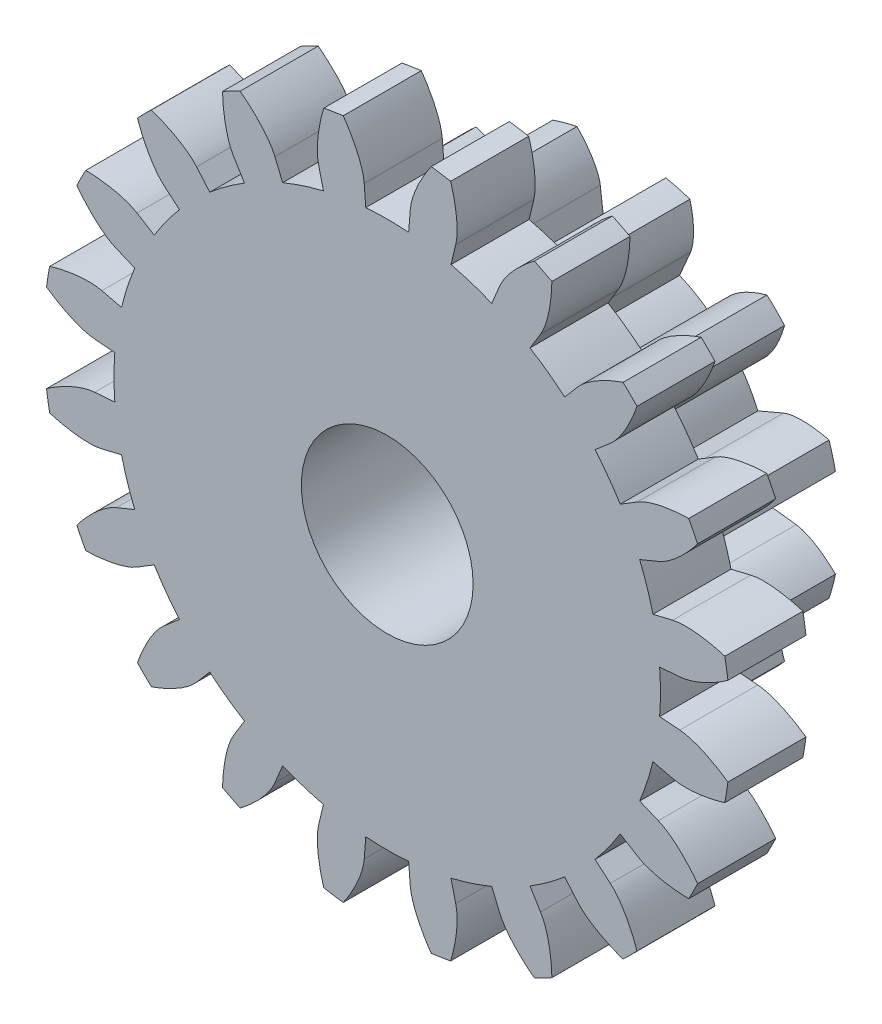
from build123d import *

# Parameters (mm, degrees)
SKETCH_1_R               = 2.8
SKETCH_1_R_2             = 1.1
EXTRUDE_1_DEPTH          = 2
CUT_EXTRUDE_1_DEPTH      = 5.436214603
PATTERN_CIRCULAR_1_COUNT = 12
PATTERN_CIRCULAR_1_ANGLE = 330
SKETCH_2_R               = 4.4
SKETCH_2_R_2             = 1.1
EXTRUDE_2_DEPTH          = 1
CUT_EXTRUDE_3_DEPTH      = 7.536054021
PATTERN_CIRCULAR_2_COUNT = 20


with BuildPart() as part:
    # 草图1 → 凸台-拉伸1 (new body)
    with BuildSketch(Plane.XY):
        Circle(SKETCH_1_R)
        Circle(SKETCH_1_R_2, mode=Mode.SUBTRACT)
    extrude(amount=EXTRUDE_1_DEPTH)

    # 草图1<3> → 切除-拉伸1 (cut, through all)
    with BuildSketch(Plane.XY):
        with BuildLine():
            Line((2.238939613, 0.270845719), (1.886248568, 0.228180496))
            ThreePointArc((1.886248568, 0.228180496), (1.896559026, 0.114297245), (1.9, 0))
            ThreePointArc((1.9, 0), (1.896559026, -0.114297245), (1.886248568, -0.228180496))
            Line((1.886248568, -0.228180496), (2.238939613, -0.270845719))
            add(Edge.make_bspline(
                [(2.238939613, -0.270845719), (2.256006445, -0.272910303), (2.303205171, -0.282218978), (2.389840348, -0.313934827), (2.521092361, -0.383706427), (2.626494766, -0.462754174), (2.701143377, -0.529750704), (2.741484226, -0.569442044)],
                knots=[0, 0, 0, 0, 0, 0.005604068, 0.015718248, 0.029959916, 0.048452597, 0.048452597, 0.048452597, 0.048452597, 0.048452597], degree=4))
            ThreePointArc((2.741484226, -0.569442044), (2.78533264, -0.286220342), (2.8, 0))
            ThreePointArc((2.8, 0), (2.78533264, 0.286220342), (2.741484226, 0.569442044))
            add(Edge.make_bspline(
                [(2.238939613, 0.270845719), (2.256006445, 0.272910303), (2.303205171, 0.282218978), (2.389840348, 0.313934827), (2.521092361, 0.383706427), (2.626494766, 0.462754174), (2.701143377, 0.529750704), (2.741484226, 0.569442044)],
                knots=[0, 0, 0, 0, 0, 0.005604068, 0.015718248, 0.029959916, 0.048452597, 0.048452597, 0.048452597, 0.048452597, 0.048452597], degree=4))
        make_face()
    cut_extrude_1 = extrude(amount=CUT_EXTRUDE_1_DEPTH, mode=Mode.SUBTRACT)

    # 阵列(圆周)1: 切除-拉伸1 ×12 about axis
    pattern_circular_1_axis = Axis((0, 0, 2), (0, 0, 1))
    for i in range(1, PATTERN_CIRCULAR_1_COUNT):
        add(cut_extrude_1.rotate(pattern_circular_1_axis, i * PATTERN_CIRCULAR_1_ANGLE / (PATTERN_CIRCULAR_1_COUNT - 1)), mode=Mode.SUBTRACT)

    # 草图2 → 凸台-拉伸2 (add)
    with BuildSketch(Plane.XY.offset(2)):
        Circle(SKETCH_2_R)
        Circle(SKETCH_2_R_2, mode=Mode.SUBTRACT)
    extrude(amount=EXTRUDE_2_DEPTH)

    # 草图2<3> → 切除-拉伸3 (cut, through all)
    with BuildSketch(Plane.XY.offset(2)):
        with BuildLine():
            Line((3.747183448, 0.294909733), (3.489210668, 0.274606835))
            ThreePointArc((3.489210668, 0.274606835), (3.497301627, 0.137409355), (3.5, 0))
            ThreePointArc((3.5, 0), (3.497301627, -0.137409355), (3.489210668, -0.274606835))
            Line((3.489210668, -0.274606835), (3.747183448, -0.294909733))
            add(Edge.make_bspline(
                [(3.747183448, -0.294909733), (3.775747214, -0.29715775), (3.854992048, -0.309367812), (4.001468441, -0.356140853), (4.155025834, -0.429702559), (4.27582317, -0.503263775), (4.349773108, -0.554039602), (4.363725168, -0.563828572)],
                knots=[0, 0, 0, 0, 0, 0.005604068, 0.015718248, 0.029959916, 0.033300535, 0.033300535, 0.033300535, 0.033300535, 0.033300535], degree=4))
            ThreePointArc((4.363725168, -0.563828572), (4.390921927, -0.282497133), (4.4, 0))
            ThreePointArc((4.4, 0), (4.390921927, 0.282497133), (4.363725168, 0.563828572))
            add(Edge.make_bspline(
                [(3.747183448, 0.294909733), (3.775747214, 0.29715775), (3.854992048, 0.309367812), (4.001468441, 0.356140853), (4.155025834, 0.429702559), (4.27582317, 0.503263775), (4.349773108, 0.554039602), (4.363725168, 0.563828572)],
                knots=[0, 0, 0, 0, 0, 0.005604068, 0.015718248, 0.029959916, 0.033300535, 0.033300535, 0.033300535, 0.033300535, 0.033300535], degree=4))
        make_face()
    cut_extrude_3 = extrude(amount=CUT_EXTRUDE_3_DEPTH, mode=Mode.SUBTRACT)

    # 阵列(圆周)2: 切除-拉伸3 ×20 about axis
    pattern_circular_2_axis = Axis((0, 0, 3), (0, 0, 1))
    for i in range(1, PATTERN_CIRCULAR_2_COUNT):
        add(cut_extrude_3.rotate(pattern_circular_2_axis, i * 360 / PATTERN_CIRCULAR_2_COUNT), mode=Mode.SUBTRACT)


solid = part.part
